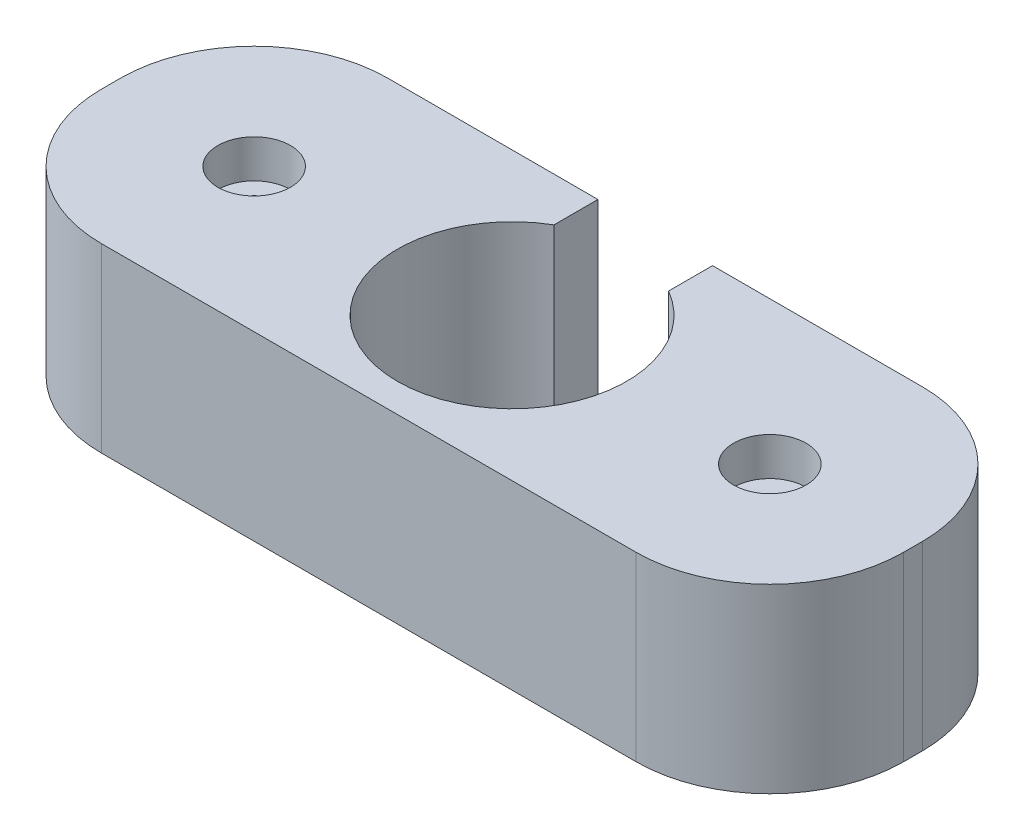
from build123d import *

# Parameters (mm, degrees)
SKETCH1_W           = 42
SKETCH1_H           = 15
BOSS_EXTRUDE1_DEPTH = 9.5
CUT_EXTRUDE1_REACH  = 47.599
SKETCH2_R           = 6
SKETCH4_R           = 1.9
CUT_EXTRUDE3_DEPTH  = 2
SKETCH5_R           = 2.05
CUT_EXTRUDE4_DEPTH  = 5
SKETCH6_R           = 0.95
CUT_EXTRUDE5_DEPTH  = 3
FILLET1_R           = 7
SKETCH7_W           = 6
SKETCH7_H           = 9.5
CUT_EXTRUDE6_DEPTH  = 3


with BuildPart() as part:
    # Sketch1 → Boss-Extrude1 (new body)
    with BuildSketch(Plane(origin=(0, 0, 0), x_dir=(1, 0, 0), z_dir=(0, 1, 0))):
        with Locations((21, 7.5)):
            Rectangle(SKETCH1_W, SKETCH1_H)
    extrude(amount=-BOSS_EXTRUDE1_DEPTH)

    # Sketch2 → Cut-Extrude1 (cut, up to next)
    with BuildSketch(Plane(origin=(0, 0, 0), x_dir=(1, 0, 0), z_dir=(0, 1, 0)), mode=Mode.PRIVATE) as cut_extrude1_sk1:
        with Locations((21, 7.5)):
            Circle(SKETCH2_R)
    cut_extrude1_tool1 = extrude(cut_extrude1_sk1.sketch, amount=-CUT_EXTRUDE1_REACH, mode=Mode.PRIVATE) & part.part
    add(cut_extrude1_tool1.solids().sort_by_distance((21, 0, -7.5))[0], mode=Mode.SUBTRACT)

    # Sketch4 → Cut-Extrude3 (cut)
    with BuildSketch(Plane(origin=(0, 0, 0), x_dir=(1, 0, 0), z_dir=(0, 1, 0))):
        with Locations((7.5, 7.5)):
            Circle(SKETCH4_R)
        with Locations((34.5, 7.5)):
            Circle(SKETCH4_R)
    extrude(amount=-CUT_EXTRUDE3_DEPTH, mode=Mode.SUBTRACT)

    # Sketch5 → Cut-Extrude4 (cut)
    with BuildSketch(Plane(origin=(0, -9.5, 0), x_dir=(-1, 0, 0), z_dir=(0, -1, 0))):
        with Locations((-34.5, 7.5)):
            Circle(SKETCH5_R)
        with Locations((-7.5, 7.5)):
            Circle(SKETCH5_R)
    extrude(amount=-CUT_EXTRUDE4_DEPTH, mode=Mode.SUBTRACT)

    # Sketch6 → Cut-Extrude5 (cut)
    with BuildSketch(Plane(origin=(0, -2, 0), x_dir=(1, 0, 0), z_dir=(0, 1, 0))):
        with Locations((7.5, 7.5)):
            Circle(SKETCH6_R)
        with Locations((34.5, 7.5)):
            Circle(SKETCH6_R)
    extrude(amount=-CUT_EXTRUDE5_DEPTH, mode=Mode.SUBTRACT)

    # Fillet1
    fillet1_edges = [part.edges().sort_by_distance(p)[0] for p in [
        (42, -4.75, -15),
        (0, -4.75, -15),
        (42, -4.75, 0),
        (0, -4.75, 0),
    ]]
    fillet(fillet1_edges, radius=FILLET1_R)

    # Sketch7 → Cut-Extrude6 (cut)
    with BuildSketch(Plane(origin=(0, 0, -15), x_dir=(-1, 0, 0), z_dir=(0, 0, -1))):
        with Locations((-21, -4.75)):
            Rectangle(SKETCH7_W, SKETCH7_H)
    extrude(amount=-CUT_EXTRUDE6_DEPTH, mode=Mode.SUBTRACT)


solid = part.part
